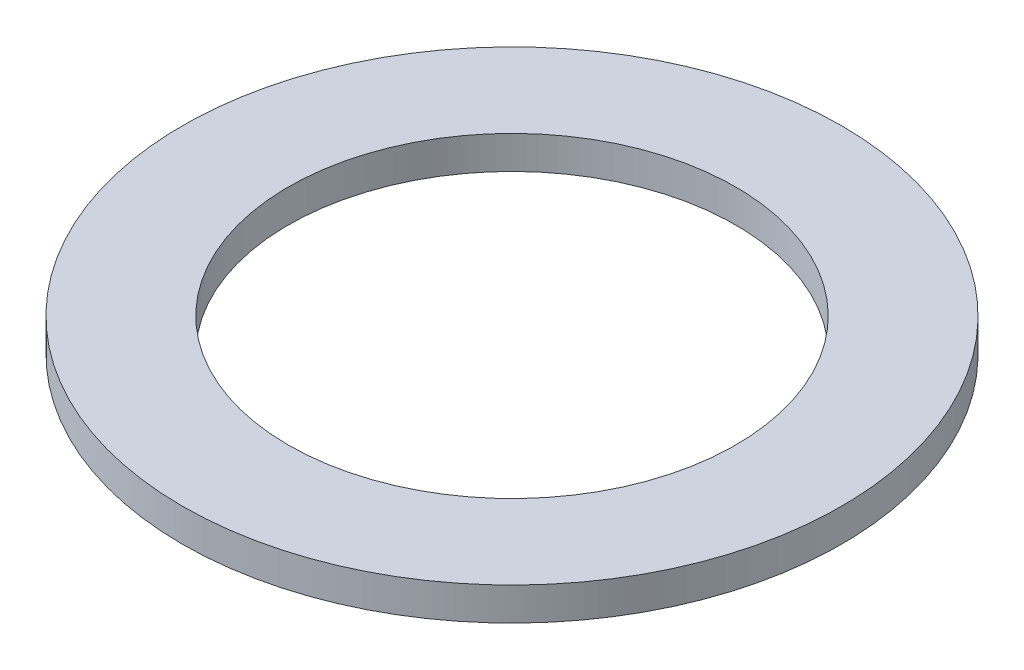
from build123d import *

# Parameters (mm, degrees)
SKETCH1_R           = 70
BOSS_EXTRUDE1_DEPTH = 7
SKETCH2_R           = 47.5
CUT_EXTRUDE1_DEPTH  = 100.242128151


with BuildPart() as part:
    # Sketch1 → Boss-Extrude1 (new body)
    with BuildSketch(Plane(origin=(0, 0, 0), x_dir=(1, 0, 0), z_dir=(0, 1, 0))):
        Circle(SKETCH1_R)
    extrude(amount=BOSS_EXTRUDE1_DEPTH)

    # Sketch2 → Cut-Extrude1 (cut, through all)
    with BuildSketch(Plane(origin=(0, 0, 0), x_dir=(1, 0, 0), z_dir=(0, 1, 0))):
        Circle(SKETCH2_R)
    extrude(amount=CUT_EXTRUDE1_DEPTH, mode=Mode.SUBTRACT)


solid = part.part
